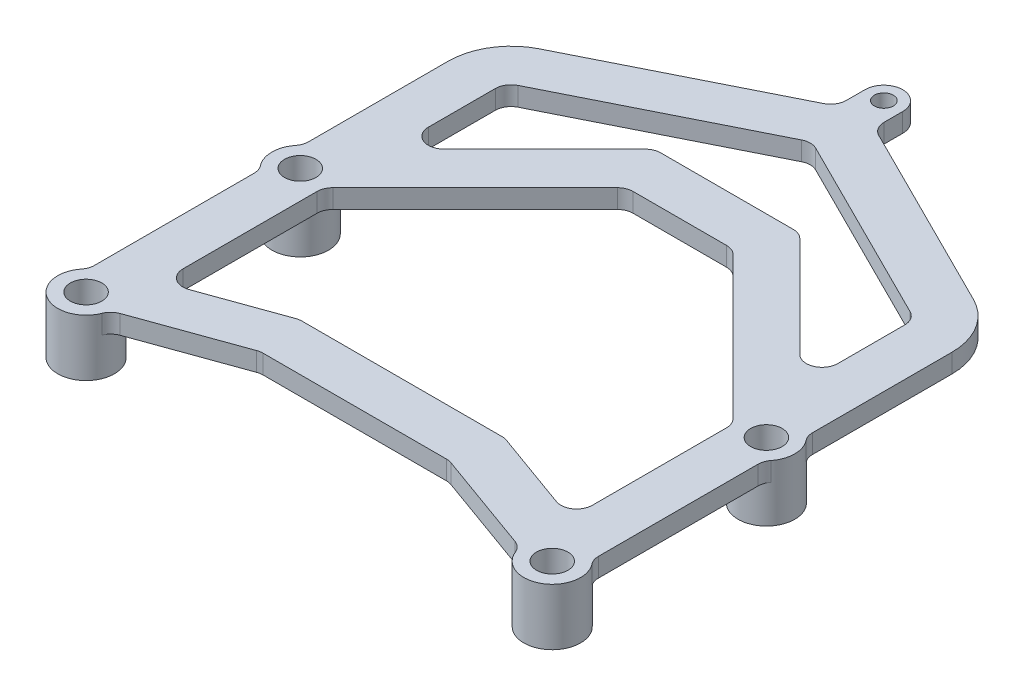
from build123d import *
from build123d.topology import SkipClean

# Parameters (mm, degrees)
SKETCH1_R            = 2.5
BOSS_EXTRUDE1_DEPTH  = 3
CUT_EXTRUDE2_START   = -3
CUT_EXTRUDE2_DEPTH   = 3
FILLET2_R            = 10
FILLET2_OF_MIRROR1_R = 10
FILLET3_R            = 2.5
BOSS_EXTRUDE2_START  = 6
SKETCH4_R            = 4.5
SKETCH4_R_2          = 2.5
BOSS_EXTRUDE2_DEPTH  = 6


# Read off the part's stored shape, not the designer's step: Cut-Extrude2
with BuildPart() as part:
    # Sketch1 → Boss-Extrude1 (new body)
    with BuildSketch(Plane(origin=(0, 0, 0), x_dir=(1, 0, 0), z_dir=(0, 1, 0))):
        with BuildLine():
            Line((0, 0), (15, 0))
            Line((15, 0), (32.55050158, -6.318180569))
            ThreePointArc((32.55050158, -6.318180569), (39.139673913, -9.604659904), (40, -2.291796068))
            Line((40, -2.291796068), (40, 25))
            ThreePointArc((40, 25), (41.5, 28.354101966), (40, 31.708203932))
            Line((40, 31.708203932), (40, 61))
            Line((40, 61), (3, 79.5))
            Line((3, 79.5), (3, 84))
            ThreePointArc((3, 84), (2.121320344, 86.121320344), (0, 87))
            Line((0, 87), (0, 85.5))
            ThreePointArc((0, 85.5), (1.5, 84), (0, 82.5))
            Line((0, 82.5), (0, 0))
        make_face()
        with Locations(Location((37, -5.645898034, 0), (0, 0, 270))):
            Circle(SKETCH1_R, mode=Mode.SUBTRACT)
        with Locations(Location((37, 28.354101966, 0), (0, 0, 270))):
            Circle(SKETCH1_R, mode=Mode.SUBTRACT)
    boss_extrude1 = extrude(amount=BOSS_EXTRUDE1_DEPTH)

    # Cut-Extrude2 outline → Cut-Extrude2 (cut)
    with BuildSketch(Plane(origin=(0, 3, 0), x_dir=(1, 0, 0), z_dir=(0, 1, 0)).offset(CUT_EXTRUDE2_START)):
        Polygon((0, 7.5), (16.308883759, 7.5), (32.5, 1.671198153), (32.5, 27.550801107), (8.446699141, 51.604101966), (0, 51.604101966), align=None)
        Polygon((0, 72.614745084), (0, 59.104101966), (11.553300859, 59.104101966), (32.5, 38.157402825), (32.5, 56.364745084), align=None)
    cut_extrude2 = extrude(amount=CUT_EXTRUDE2_DEPTH, mode=Mode.SUBTRACT)

    # Fillet2
    fillet2_edges = [part.edges().sort_by_distance(p)[0] for p in [
        (40, 1.5, -61),
    ]]
    fillet(fillet2_edges, radius=FILLET2_R)

    # Mirror1: Boss-Extrude1, Cut-Extrude2 across plane
    with SkipClean():  # the faces are left unmerged after this step: merging them gives an invalid solid
        add(boss_extrude1.mirror(Plane(origin=(0, 0, 0), x_dir=(0, 0, 1), z_dir=(1, 0, 0))))
        add(cut_extrude2.mirror(Plane(origin=(0, 0, 0), x_dir=(0, 0, 1), z_dir=(1, 0, 0))), mode=Mode.SUBTRACT)

    # Fillet2 of Mirror1
    fillet2_of_mirror1_edges = [part.edges().sort_by_distance(p)[0] for p in [
        (-40, 1.5, -61),
    ]]
    fillet(fillet2_of_mirror1_edges, radius=FILLET2_OF_MIRROR1_R)

    # Fillet3
    fillet3_edges = [part.edges().sort_by_distance(p)[0] for p in [
        (-40, 1.5, 2.291796068),
        (-32.55050158, 1.5, 6.318180569),
        (-15, 1.5, 0),
        (-3, 1.5, -79.5),
        (-40, 1.5, -31.708203932),
        (-40, 1.5, -25),
        (-16.308883759, 1.5, -7.5),
        (-32.5, 1.5, -1.671198153),
        (-32.5, 1.5, -27.550801107),
        (-8.446699141, 1.5, -51.604101966),
        (-11.553300859, 1.5, -59.104101966),
        (-32.5, 1.5, -38.157402825),
        (-32.5, 1.5, -56.364745084),
        (32.55050158, 1.5, 6.318180569),
        (15, 1.5, 0),
        (3, 1.5, -79.5),
        (40, 1.5, -31.708203932),
        (40, 1.5, -25),
        (40, 1.5, 2.291796068),
        (32.5, 1.5, -1.671198153),
        (16.308883759, 1.5, -7.5),
        (8.446699141, 1.5, -51.604101966),
        (32.5, 1.5, -27.550801107),
        (32.5, 1.5, -38.157402825),
        (11.553300859, 1.5, -59.104101966),
        (0, 1.5, -72.614745084),
        (32.5, 1.5, -56.364745084),
    ]]
    fillet(fillet3_edges, radius=FILLET3_R)

    # Sketch4 → Boss-Extrude2 (add)
    # profile 1 of 4: a face of its own
    with SkipClean():  # the faces are left unmerged after this step: merging them gives an invalid solid
        with BuildSketch(Plane.XZ.offset(BOSS_EXTRUDE2_START)):
            with Locations(Location((37, -28.354101966, 0), (0, 0, 270))):
                Circle(SKETCH4_R)
            with Locations(Location((37, -28.354101966, 0), (0, 0, 270))):
                Circle(SKETCH4_R_2, mode=Mode.SUBTRACT)
        # profile 2 of 4: a face of its own
        with BuildSketch(Plane.XZ.offset(BOSS_EXTRUDE2_START)):
            with Locations(Location((37, 5.645898034, 0), (0, 0, 270))):
                Circle(SKETCH4_R)
            with Locations(Location((37, 5.645898034, 0), (0, 0, 270))):
                Circle(SKETCH4_R_2, mode=Mode.SUBTRACT)
        # profile 3 of 4: a face of its own
        with BuildSketch(Plane.XZ.offset(BOSS_EXTRUDE2_START)):
            with Locations(Location((-37, -28.354101966, 0), (0, 0, 270))):
                Circle(SKETCH4_R)
            with Locations(Location((-37, -28.354101966, 0), (0, 0, 270))):
                Circle(SKETCH4_R_2, mode=Mode.SUBTRACT)
        # profile 4 of 4: a face of its own
        with BuildSketch(Plane.XZ.offset(BOSS_EXTRUDE2_START)):
            with Locations(Location((-37, 5.645898034, 0), (0, 0, 270))):
                Circle(SKETCH4_R)
            with Locations(Location((-37, 5.645898034, 0), (0, 0, 270))):
                Circle(SKETCH4_R_2, mode=Mode.SUBTRACT)
        extrude(amount=-BOSS_EXTRUDE2_DEPTH)


solid = part.part
